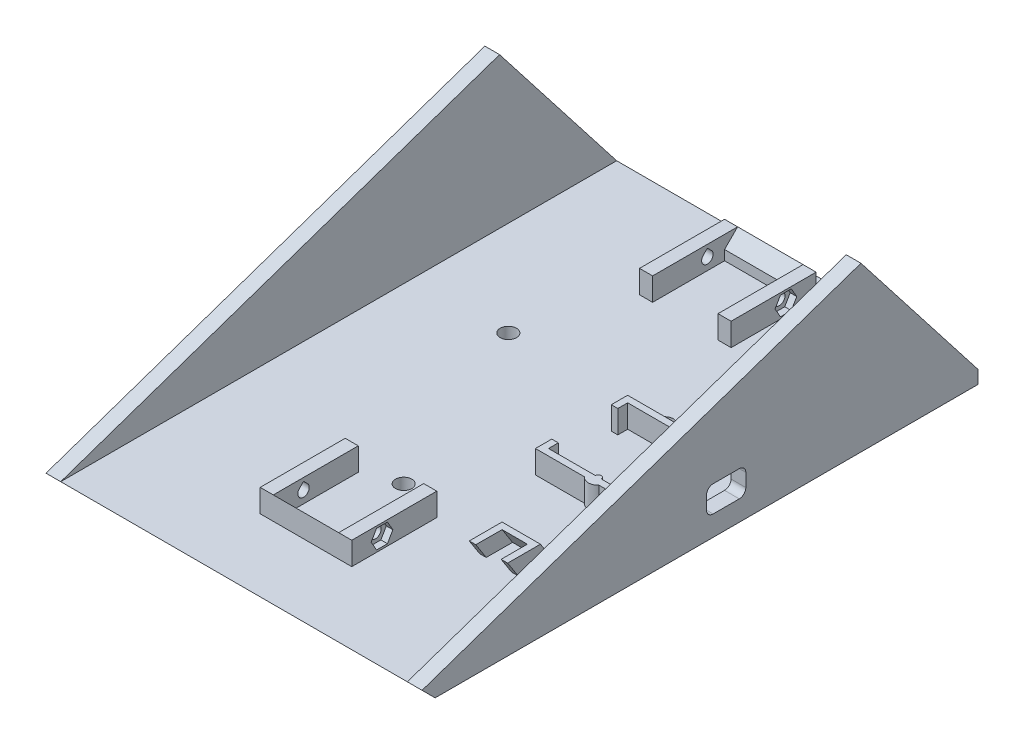
from build123d import *

# Parameters (mm, degrees)
SKETCH1_W                  = 110.5
SKETCH1_H                  = 170
SKETCH1_W_2                = 4.5
BOSS_EXTRUDE1_DEPTH        = 4
SKETCH1_4_W                = 4.5
SKETCH1_4_H                = 170
BOSS_EXTRUDE2_DEPTH        = 50
CUT_EXTRUDE1_DEPTH         = 4.5
SALIENTE_EXTRUIR1_DEPTH    = 7
SALIENTE_EXTRUIR2_DEPTH    = 7
CORTAR_EXTRUIR1_DEPTH      = 31
CORTAR_EXTRUIR1_DEPTH_BACK = 7
CORTAR_EXTRUIR2_DEPTH      = 2
CHAFL_N1_SIZE              = 4
CHAFL_N2_SIZE              = 4
CROQUIS5_R                 = 2.5
CORTAR_EXTRUIR3_DEPTH      = 23.7
CHAFL_N3_SIZE              = 4
SALIENTE_EXTRUIR4_DEPTH    = 7
CROQUIS8_W                 = 12
CROQUIS8_H                 = 8
CORTAR_EXTRUIR4_DEPTH      = 7
REDONDEO1_R                = 2


with BuildPart() as part:
    # Sketch1 → Boss-Extrude1 (new body)
    with BuildSketch(Plane(origin=(0, 0, 0), x_dir=(1, 0, 0), z_dir=(0, 1, 0))):
        with Locations((59.75, 85)):
            Rectangle(SKETCH1_W, SKETCH1_H)
        with Locations((2.25, 85)):
            Rectangle(SKETCH1_W_2, SKETCH1_H)
    extrude(amount=BOSS_EXTRUDE1_DEPTH)

    # Sketch1<4> → Boss-Extrude2 (add)
    with BuildSketch(Plane(origin=(0, 0, 0), x_dir=(1, 0, 0), z_dir=(0, 1, 0))):
        with Locations((2.25, 85)):
            Rectangle(SKETCH1_4_W, SKETCH1_4_H)
    boss_extrude2 = extrude(amount=BOSS_EXTRUDE2_DEPTH)

    # Sketch2 → Cut-Extrude1 (cut)
    with BuildSketch(Plane.ZY):
        Polygon((-134.204014838, 50), (-170, 4), (-182.392562203, 4), (-182.392562203, 57.402643918), (5.745866014, 57.402643918), (5.745866014, 4), (0, 4), align=None)
    cut_extrude1 = extrude(amount=-CUT_EXTRUDE1_DEPTH, mode=Mode.SUBTRACT)

    # Mirror1: Boss-Extrude2, Cut-Extrude1 across plane
    add(boss_extrude2.mirror(Plane(origin=(57.5, 0, 0), x_dir=(0, 0, 1), z_dir=(1, 0, 0))))
    add(cut_extrude1.mirror(Plane(origin=(57.5, 0, 0), x_dir=(0, 0, 1), z_dir=(1, 0, 0))), mode=Mode.SUBTRACT)

    # Sketch3 → Saliente-Extruir1 (add)
    with BuildSketch(Plane(origin=(0, 4, 0), x_dir=(1, 0, 0), z_dir=(0, 1, 0))):
        Polygon((57.5, 160), (47.5, 160), (47.5, 142), (47.5, 138), (43.5, 138), (43.5, 164), (57.5, 164), align=None)
    saliente_extruir1 = extrude(amount=SALIENTE_EXTRUIR1_DEPTH)

    # Croquis1 → Saliente-Extruir2 (add)
    with BuildSketch(Plane(origin=(0, 4, 0), x_dir=(1, 0, 0), z_dir=(0, 1, 0))):
        Polygon((57.5, 26), (57.5, 22), (43.5, 22), (43.5, 48), (47.5, 48), (47.5, 26), align=None)
    saliente_extruir2 = extrude(amount=SALIENTE_EXTRUIR2_DEPTH)

    # Simetría1: Saliente-Extruir1, Saliente-Extruir2 across plane
    add(saliente_extruir1.mirror(Plane(origin=(57.5, 11, -164), x_dir=(0, 0, 1), z_dir=(-1, 0, 0))))
    add(saliente_extruir2.mirror(Plane(origin=(57.5, 11, -164), x_dir=(0, 0, 1), z_dir=(-1, 0, 0))))

    # Croquis2 → Cortar-Extruir1 (cut, two sides: drawn at the far end of the back side and taken through both)
    with BuildSketch(Plane(origin=(47.5, 0, 0), x_dir=(0, 0, -1), z_dir=(1, 0, 0)).offset(-CORTAR_EXTRUIR1_DEPTH_BACK)):
        with BuildLine():
            Line((31.25, 9.974873734), (32.487436867, 8.737436867))
            ThreePointArc((32.487436867, 8.737436867), (31.25, 5.75), (30.012563133, 8.737436867))
            Line((30.012563133, 8.737436867), (31.25, 9.974873734))
        make_face()
        with BuildLine():
            Line((154.75, 9.974873734), (155.987436867, 8.737436867))
            ThreePointArc((155.987436867, 8.737436867), (154.75, 5.75), (153.512563133, 8.737436867))
            Line((153.512563133, 8.737436867), (154.75, 9.974873734))
        make_face()
    extrude(amount=CORTAR_EXTRUIR1_DEPTH + CORTAR_EXTRUIR1_DEPTH_BACK, mode=Mode.SUBTRACT)

    # Croquis4 → Cortar-Extruir2 (cut)
    with BuildSketch(Plane(origin=(71.5, 0, 0), x_dir=(0, 0, -1), z_dir=(1, 0, 0))):
        Polygon((158.069764048, 7.5), (156.409882024, 10.375), (153.090117976, 10.375), (151.430235952, 7.5), (153.090117976, 4.625), (156.409882024, 4.625), align=None)
        Polygon((29.590117976, 4.625), (27.930235952, 7.5), (29.590117976, 10.375), (32.909882024, 10.375), (34.569764048, 7.5), (32.909882024, 4.625), align=None)
    extrude(amount=-CORTAR_EXTRUIR2_DEPTH, mode=Mode.SUBTRACT)

    # Chaflán1
    chafl_n1_edges = [part.edges().sort_by_distance(p)[0] for p in [
        (57.5, 11, -26),
    ]]
    chamfer(chafl_n1_edges, length=CHAFL_N1_SIZE - 0.0001)  # a hair under: the kernel refuses the full size

    # Chaflán2
    chafl_n2_edges = [part.edges().sort_by_distance(p)[0] for p in [
        (57.5, 11, -160),
    ]]
    chamfer(chafl_n2_edges, length=CHAFL_N2_SIZE - 0.0001)  # a hair under: the kernel refuses the full size

    # Croquis5 → Cortar-Extruir3 (cut)
    with BuildSketch(Plane(origin=(0, 4, 0), x_dir=(1, 0, 0), z_dir=(0, 1, 0))):
        with Locations(Location((33.545716199, 107.830838948, 0), (0, 0, 270))):
            Circle(CROQUIS5_R)
        with Locations(Location((57.5, 51.866184435, 0), (0, 0, 270))):
            Circle(CROQUIS5_R)
        with Locations(Location((81.454283801, 107.830838948, 0), (0, 0, 270))):
            Circle(CROQUIS5_R)
    extrude(amount=-CORTAR_EXTRUIR3_DEPTH, mode=Mode.SUBTRACT)

    # Chaflán3
    chafl_n3_edges = [part.edges().sort_by_distance(p)[0] for p in [
        (57.5, 0, 0),
    ]]
    chamfer(chafl_n3_edges, length=CHAFL_N3_SIZE - 0.0001)  # a hair under: the kernel refuses the full size

    # Saliente-Extruir3: read off the stored shape, not the designer's step
    # Saliente-Extruir3: loft between two sections, ruled curve by curve
    saliente_extruir3_from = [
        Edge.make_line((89.622165017, 4, -44.992823986), (87.622165017, 4, -44.990685532)),
        Edge.make_line((89.66503142, 4, -53.010916957), (89.622165017, 4, -44.992823986)),
        Edge.make_line((89.66503142, 4, -53.010916957), (97.363741989, 4, -53.010916957)),
        Edge.make_line((97.363741989, 4, -53.010916957), (97.363741989, 4, -44.990685532)),
        Edge.make_line((97.363741989, 4, -44.990685532), (99.363741989, 4, -44.990685532)),
        Edge.make_line((99.363741989, 4, -44.990685532), (99.363741989, 4, -55.010916957)),
        Edge.make_line((99.363741989, 4, -55.010916957), (87.622165017, 4, -55.010916957)),
        Edge.make_line((87.622165017, 4, -44.990685532), (87.622165017, 4, -55.010916957)),
    ]
    saliente_extruir3_to = [
        Edge.make_line((89.622165017, 8.969440836, -41.812469009), (87.622165017, 8.969440836, -41.810330556)),
        Edge.make_line((89.66503142, 8.969440836, -49.83056198), (89.622165017, 8.969440836, -41.812469009)),
        Edge.make_line((89.66503142, 8.969440836, -49.83056198), (97.363741989, 8.969440836, -49.83056198)),
        Edge.make_line((97.363741989, 8.969440836, -49.83056198), (97.363741989, 8.969440836, -41.810330556)),
        Edge.make_line((97.363741989, 8.969440836, -41.810330556), (99.363741989, 8.969440836, -41.810330556)),
        Edge.make_line((99.363741989, 8.969440836, -41.810330556), (99.363741989, 8.969440836, -51.83056198)),
        Edge.make_line((99.363741989, 8.969440836, -51.83056198), (87.622165017, 8.969440836, -51.83056198)),
        Edge.make_line((87.622165017, 8.969440836, -41.810330556), (87.622165017, 8.969440836, -51.83056198)),
    ]
    saliente_extruir3 = Solid(Shell([*[Face.make_surface_from_curves(saliente_extruir3_from[k], saliente_extruir3_to[k]) for k in range(8)], Face(Wire(saliente_extruir3_from)), Face(Wire(saliente_extruir3_to))]))
    add(saliente_extruir3)

    # Croquis7 → Saliente-Extruir4 (add)
    with BuildSketch(Plane(origin=(0, 4, 0), x_dir=(1, 0, 0), z_dir=(0, 1, 0))):
        with BuildLine():
            Line((93.557674933, 100.575775557), (95.79024416, 100.575775557))
            Line((95.79024416, 100.575775557), (97.79024416, 100.575775557))
            Line((97.79024416, 100.575775557), (97.79024416, 102.575775557))
            Line((97.79024416, 102.575775557), (94.59024416, 102.575775557))
            ThreePointArc((94.59024416, 102.575775557), (92.49024416, 103.475775557), (90.39024416, 102.575775557))
            Line((90.39024416, 102.575775557), (75.29024416, 102.575775557))
            Line((75.29024416, 102.575775557), (75.29024416, 97.575775557))
            Line((75.29024416, 97.575775557), (77.29024416, 97.575775557))
            Line((77.29024416, 97.575775557), (77.29024416, 100.575775557))
            Line((77.29024416, 100.575775557), (80.20924649, 100.575775557))
            Line((80.20924649, 100.575775557), (91.59024416, 100.575775557))
            ThreePointArc((91.59024416, 100.575775557), (92.49024416, 99.675775557), (93.39024416, 100.575775557))
            Line((93.39024416, 100.575775557), (93.557674933, 100.575775557))
        make_face()
        with BuildLine():
            Line((94.726312137, 74.375775557), (97.79024416, 74.375775557))
            Line((97.79024416, 74.375775557), (97.79024416, 76.375775557))
            Line((97.79024416, 76.375775557), (95.79024416, 76.375775557))
            Line((95.79024416, 76.375775557), (93.39024416, 76.375775557))
            ThreePointArc((93.39024416, 76.375775557), (92.49024416, 77.275775557), (91.59024416, 76.375775557))
            Line((91.59024416, 76.375775557), (83.611986998, 76.375775557))
            Line((83.611986998, 76.375775557), (77.29024416, 76.375775557))
            Line((77.29024416, 76.375775557), (77.29024416, 79.375775557))
            Line((77.29024416, 79.375775557), (75.29024416, 79.375775557))
            Line((75.29024416, 79.375775557), (75.29024416, 74.375775557))
            Line((75.29024416, 74.375775557), (90.254176182, 74.375775557))
            ThreePointArc((90.254176182, 74.375775557), (92.49024416, 73.375775557), (94.726312137, 74.375775557))
        make_face()
    extrude(amount=SALIENTE_EXTRUIR4_DEPTH)

    # Croquis8 → Cortar-Extruir4 (cut)
    with BuildSketch(Plane.ZY.offset(-110.5)):
        with Locations((-92.994977689, 10.20633678)):
            Rectangle(CROQUIS8_W, CROQUIS8_H)
    extrude(amount=-CORTAR_EXTRUIR4_DEPTH, mode=Mode.SUBTRACT)

    # Redondeo1
    redondeo1_edges = [part.edges().sort_by_distance(p)[0] for p in [
        (112.75, 14.20633678, -98.994977689),
        (112.75, 14.20633678, -86.994977689),
        (112.75, 6.20633678, -86.994977689),
        (112.75, 6.20633678, -98.994977689),
    ]]
    fillet(redondeo1_edges, radius=REDONDEO1_R)


solid = part.part
